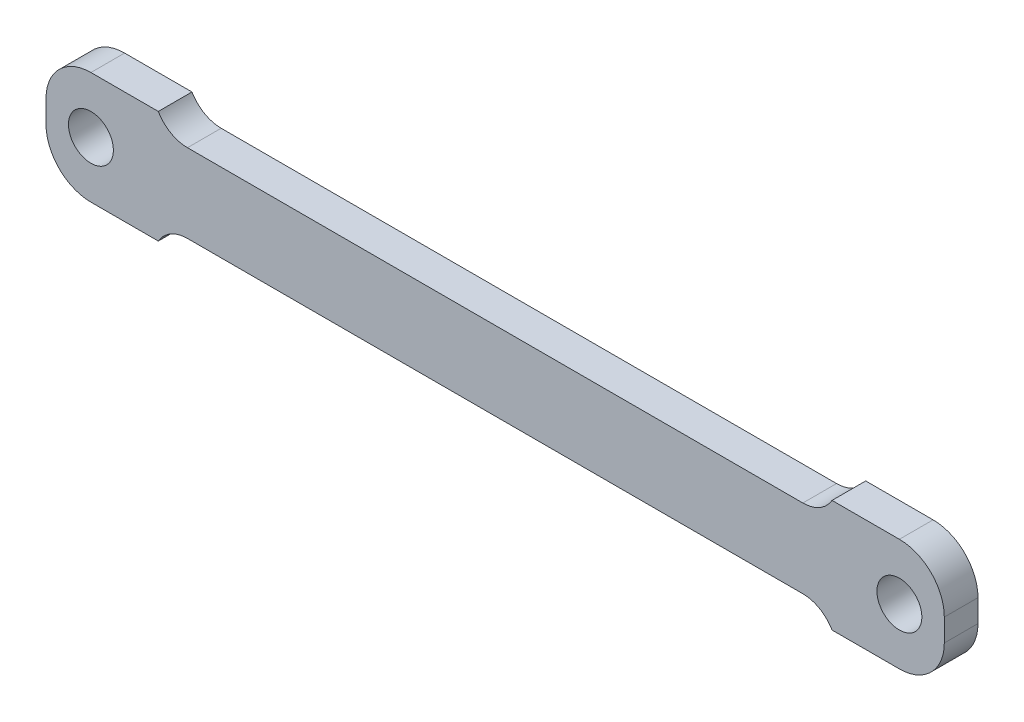
from build123d import *

# Parameters (mm, degrees)
SKETCH1_R           = 1
BOSS_EXTRUDE1_DEPTH = 1.5
SKETCH2_W           = 30
SKETCH2_H           = 1.5
CUT_EXTRUDE1_DEPTH  = 21.211382931
FILLET1_R           = 1.5


with BuildPart() as part:
    # Sketch1 → Boss-Extrude1 (new body)
    with BuildSketch(Plane.XY):
        with BuildLine():
            Line((-18, 2.5), (18, 2.5))
            ThreePointArc((18, 2.5), (19.414213562, 1.914213562), (20, 0.5))
            Line((20, 0.5), (20, -0.5))
            ThreePointArc((20, -0.5), (19.414213562, -1.914213562), (18, -2.5))
            Line((18, -2.5), (-18, -2.5))
            ThreePointArc((-18, -2.5), (-19.414213562, -1.914213562), (-20, -0.5))
            Line((-20, -0.5), (-20, 0.5))
            ThreePointArc((-20, 0.5), (-19.414213562, 1.914213562), (-18, 2.5))
        make_face()
        with Locations((18, 0)):
            Circle(SKETCH1_R, mode=Mode.SUBTRACT)
        with Locations((-18, 0)):
            Circle(SKETCH1_R, mode=Mode.SUBTRACT)
    extrude(amount=BOSS_EXTRUDE1_DEPTH)

    # Sketch2 → Cut-Extrude1 (cut, through all)
    with BuildSketch(Plane(origin=(0, 0, 0), x_dir=(-1, 0, 0), z_dir=(0, 0, -1))):
        with Locations((0, 2.5)):
            Rectangle(SKETCH2_W, SKETCH2_H)
        with Locations((0, -2.5)):
            Rectangle(SKETCH2_W, SKETCH2_H)
    extrude(amount=-CUT_EXTRUDE1_DEPTH, mode=Mode.SUBTRACT)

    # Fillet1
    # the kernel refuses this fillet: 1.5 mm, written as the material it adds along each edge
    with BuildSketch(Plane(origin=(15, 1.75, 0), x_dir=(0, 1, 0), z_dir=(0, 0, 1)), Plane(origin=(-15, -1.75, 0), x_dir=(0, -1, 0), z_dir=(0, 0, 1))) as fillet1_piece_1:
        with BuildLine():
            CenterArc((1.5, 1.299038106), FILLET1_R, 180, 60)
            Line((0, 1.299038106), (-0.03, 1.299038106))
            Line((-0.03, 1.299038106), (-0.03, 0))
            Line((-0.03, 0), (0, -0.03))
            ThreePointArc((0, -0.03), (0.375, -0.03), (0.735, -0.025980762))
            Line((0.735, -0.025980762), (0.75, 0))
        make_face()
    extrude(amount=1.5)
    with BuildSketch(Plane(origin=(15, -1.75, 0), x_dir=(-1, 0, 0), z_dir=(0, 0, 1))) as fillet1_piece_2:
        with BuildLine():
            CenterArc((1.299038106, 1.5), FILLET1_R, 210, 60)
            Line((0, 0.75), (-0.025980762, 0.735))
            ThreePointArc((-0.025980762, 0.735), (-0.03, 0.375), (-0.03, 0))
            Line((-0.03, 0), (0, -0.03))
            Line((0, -0.03), (1.299038106, -0.03))
            Line((1.299038106, -0.03), (1.299038106, 0))
        make_face()
    extrude(amount=1.5)
    with BuildSketch(Plane(origin=(-15, 1.75, 0), x_dir=(0, 1, 0), z_dir=(0, 0, 1))) as fillet1_piece_3:
        with BuildLine():
            CenterArc((1.5, -1.299038106), FILLET1_R, 120, 60)
            Line((0, -1.299038106), (-0.03, -1.299038106))
            Line((-0.03, -1.299038106), (-0.03, 0))
            Line((-0.03, 0), (0, 0.03))
            ThreePointArc((0, 0.03), (0.375, 0.03), (0.735, 0.025980762))
            Line((0.735, 0.025980762), (0.75, 0))
        make_face()
    extrude(amount=1.5)


solid = part.part
